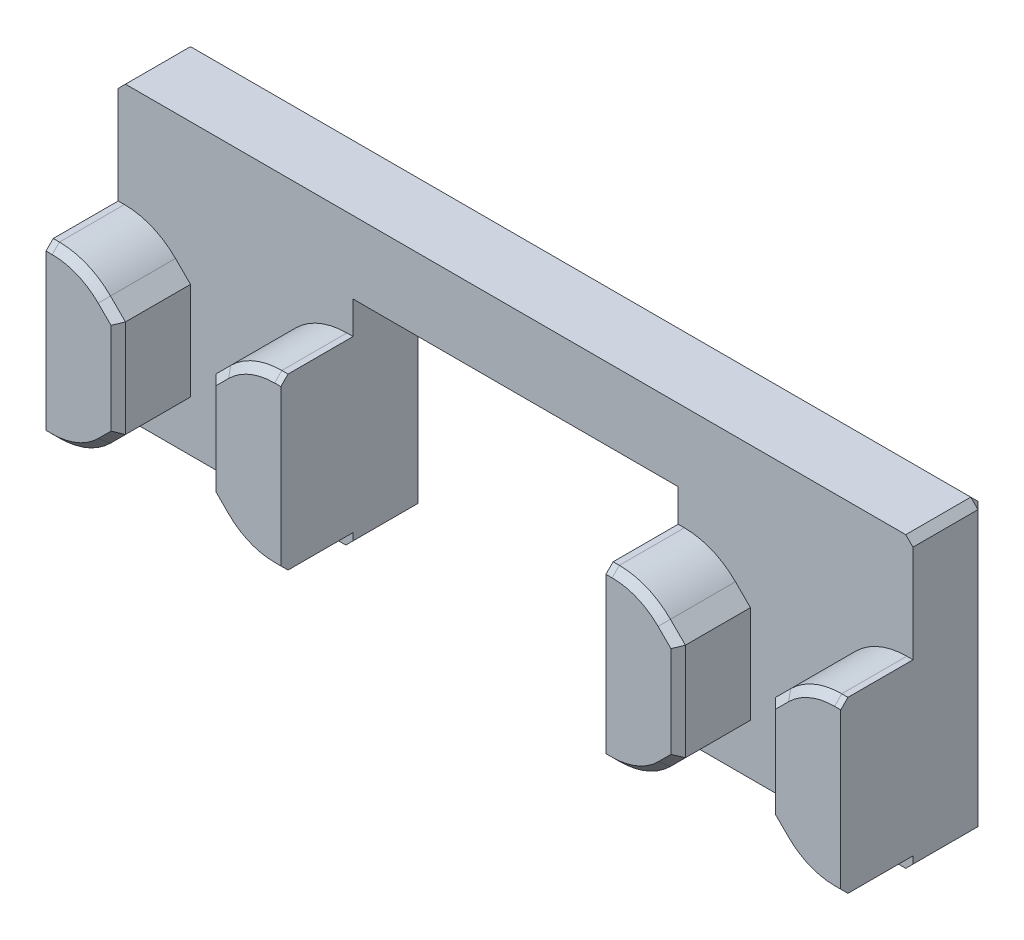
from build123d import *

# Parameters (mm, degrees)
BOSS_EXTRUDE1_DEPTH  = 2
BOSS_EXTRUDE2_DEPTH  = 2
MIRROR2_COPY_1_DEPTH = 2
MIRROR2_COPY_2_DEPTH = 2
DEBURS_SIZE          = 0.2


with BuildPart() as part:
    # Sketch1 → Boss-Extrude1 (new body)
    with BuildSketch(Plane.XY):
        Polygon((-11, 4), (11, 4), (11, -4), (4.5, -4), (4.5, 2), (-4.5, 2), (-4.5, -4), (-11, -4), align=None)
    extrude(amount=-BOSS_EXTRUDE1_DEPTH)

    # Sketch2 → Boss-Extrude2 (add)
    with BuildSketch(Plane.XY):
        with BuildLine():
            Line((11, 1.1), (10.828427125, 1.1))
            ThreePointArc((10.828427125, 1.1), (10.06306026, 0.947759065), (9.414213562, 0.514213562))
            Line((9.414213562, 0.514213562), (9, 0.1))
            Line((9, 0.1), (9, -2.6))
            Line((9, -2.6), (9.414213562, -3.014213562))
            ThreePointArc((9.414213562, -3.014213562), (10.06306026, -3.447759065), (10.828427125, -3.6))
            Line((10.828427125, -3.6), (11, -3.6))
            Line((11, -3.6), (11, 1.1))
        make_face()
    boss_extrude2 = extrude(amount=BOSS_EXTRUDE2_DEPTH)

    # Mirror1: Boss-Extrude2 across plane
    add(boss_extrude2.mirror(Plane(origin=(7.75, 0, 0), x_dir=(0, 0, 1), z_dir=(1, 0, 0))))

    # Mirror2 copy 1 sketch → Mirror2 copy 1 (add)
    with BuildSketch(Plane(origin=(-15.5, 0, 0), x_dir=(1, 0, 0), z_dir=(0, 0, 1))):
        with BuildLine():
            Line((11, 1.1), (10.828427125, 1.1))
            ThreePointArc((10.828427125, 1.1), (10.06306026, 0.947759065), (9.414213562, 0.514213562))
            Line((9.414213562, 0.514213562), (9, 0.1))
            Line((9, 0.1), (9, -2.6))
            Line((9, -2.6), (9.414213562, -3.014213562))
            ThreePointArc((9.414213562, -3.014213562), (10.06306026, -3.447759065), (10.828427125, -3.6))
            Line((10.828427125, -3.6), (11, -3.6))
            Line((11, -3.6), (11, 1.1))
        make_face()
    extrude(amount=MIRROR2_COPY_1_DEPTH)

    # Mirror2 copy 2 sketch → Mirror2 copy 2 (add)
    with BuildSketch(Plane(origin=(0, 0, 0), x_dir=(-1, 0, 0), z_dir=(0, 0, 1))):
        with BuildLine():
            Line((11, -1.1), (10.828427125, -1.1))
            ThreePointArc((10.828427125, -1.1), (10.06306026, -0.947759065), (9.414213562, -0.514213562))
            Line((9.414213562, -0.514213562), (9, -0.1))
            Line((9, -0.1), (9, 2.6))
            Line((9, 2.6), (9.414213562, 3.014213562))
            ThreePointArc((9.414213562, 3.014213562), (10.06306026, 3.447759065), (10.828427125, 3.6))
            Line((10.828427125, 3.6), (11, 3.6))
            Line((11, 3.6), (11, -1.1))
        make_face()
    extrude(amount=MIRROR2_COPY_2_DEPTH)

    # Deburs
    deburs_edges = [part.edges().sort_by_distance(p)[0] for p in [
        (0, 4, -2),
        (11, 4, -1),
        (11, 0, -2),
        (11, -4, -1),
        (7.75, -4, -2),
        (4.5, -4, -1),
        (4.5, -1, -2),
        (0, 2, -2),
        (-4.5, -1, -2),
        (-4.5, -4, -1),
        (-7.75, -4, -2),
        (-11, 4, -1),
        (-11, 0, -2),
        (-11, -4, -1),
        (10.914213562, 1.1, 2),
        (10.06306026, 0.947759065, 2),
        (9.207106781, 0.307106781, 2),
        (9, -1.25, 2),
        (9.207106781, -2.807106781, 2),
        (10.914213562, -3.6, 2),
        (10.06306026, -3.447759065, 2),
        (4.585786438, 1.1, 2),
        (6.292893219, 0.307106781, 2),
        (5.43693974, 0.947759065, 2),
        (6.5, -1.25, 2),
        (6.292893219, -2.807106781, 2),
        (4.585786438, -3.6, 2),
        (5.43693974, -3.447759065, 2),
        (-10.914213562, 1.1, 2),
        (-9.207106781, 0.307106781, 2),
        (-10.06306026, 0.947759065, 2),
        (-4.585786438, 1.1, 2),
        (-6.292893219, 0.307106781, 2),
        (-5.43693974, 0.947759065, 2),
        (-4.585786438, -3.6, 2),
        (-5.43693974, -3.447759065, 2),
        (-6.5, -1.25, 2),
        (-6.292893219, -2.807106781, 2),
        (-9, -1.25, 2),
        (-9.207106781, -2.807106781, 2),
        (-10.914213562, -3.6, 2),
        (-10.06306026, -3.447759065, 2),
    ]]
    chamfer(deburs_edges, length=DEBURS_SIZE)


solid = part.part
